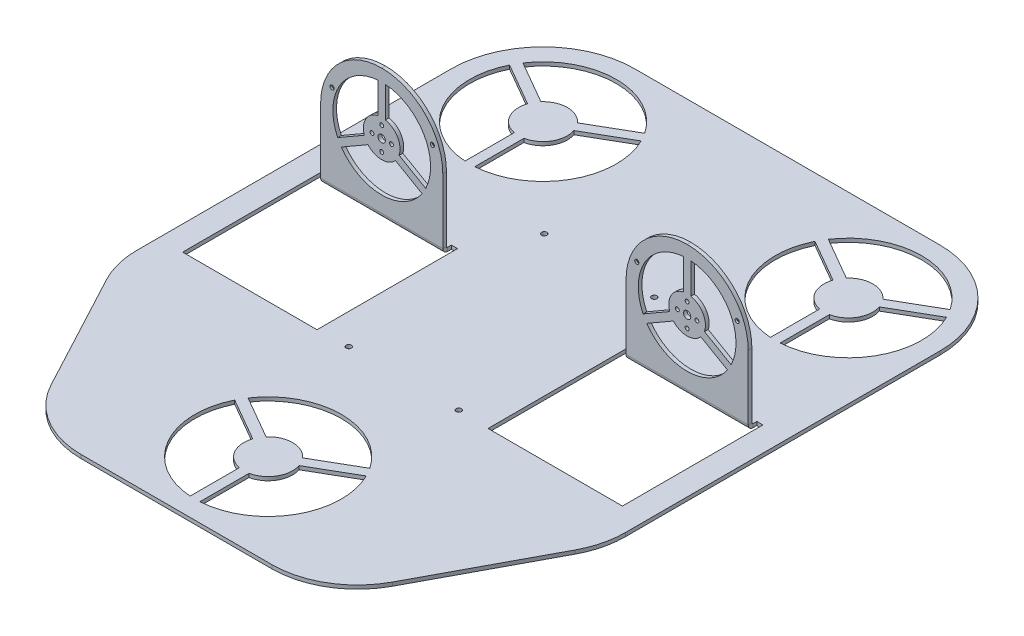
from build123d import *

# Parameters (mm, degrees)
BOSS_EXTRUDE1_DEPTH                                 = 3
FILLET1_R                                           = 70
CUT_EXTRUDE1_REACH                                  = 540.525
FILLET2_R                                           = 50
SKETCHED_BEND1_OUTLINE_W                            = 400
SKETCHED_BEND1_OUTLINE_H                            = 3
SKETCHED_BEND1_DEPTH                                = 202.963495408
SKETCHED_START                                      = 315
SKETCHED_BEND1_2_OUTLINE_W                          = 400
SKETCHED_BEND1_2_OUTLINE_H                          = 3
SKETCHED_BEND1_2_DEPTH                              = 185
SKETCHED_START_2                                    = 205.963495408
SKETCHED_BEND1_3_OUTLINE_W                          = 20
SKETCHED_BEND1_3_OUTLINE_H                          = 3
SKETCHED_BEND1_3_OUTLINE_W_2                        = 140
SKETCHED_BEND1_3_DEPTH                              = 109.036504592
SKETCHED_START_3                                    = 202.963495408
SKETCHED_BEND1_4_DEPTH                              = 3
SKETCHED_BEND1_5_DEPTH                              = 1
SKETCHED_START_4                                    = -201
SKETCHED_BEND1_6_DEPTH                              = 402
SKETCHED_START_5                                    = -175
SKETCHED_BEND1_7_DEPTH                              = 100
SKETCHED_START_6                                    = 75
SKETCHED_BEND1_8_DEPTH                              = 100
SKETCHED_START_7                                    = -75
SKETCHED_BEND1_9_DEPTH                              = 150
SKETCHED_BEND1_10_DEPTH                             = 26
SKETCHED_START_8                                    = 175
SKETCHED_BEND1_11_DEPTH                             = 26
SKETCH9_R                                           = 40
SKETCH9_R_2                                         = 15
CUT_EXTRUDE2_DEPTH                                  = 472.091933323
SKETCH16_W                                          = 6
SKETCH16_H                                          = 35.212980397
BOSS_EXTRUDE2_DEPTH                                 = 3
CIRPATTERN1_COUNT                                   = 3
SKETCH19_W                                          = 6
SKETCH19_H                                          = 35.212980397
BOSS_EXTRUDE3_DEPTH                                 = 3
CIRPATTERN2_COUNT                                   = 3
M3_CLEARANCE_HOLE1_D                                = 3.2
CUT_EXTRUDE3_REACH                                  = 473.092
SKETCH22_R                                          = 3
CSK_FOR_M3_COUNTERSUNK_FLAT_HEAD_SCREW3_D           = 3.4
CSK_FOR_M3_COUNTERSUNK_FLAT_HEAD_SCREW3_CSINK_D     = 6.3
CSK_FOR_M3_COUNTERSUNK_FLAT_HEAD_SCREW3_CSINK_ANGLE = 90
M4_CLEARANCE_HOLE1_D                                = 4.3


with BuildPart() as part:
    # Sketch1 → Boss-Extrude1 (new body)
    with BuildSketch(Plane.XY):
        with BuildLine():
            Line((-200, 350), (-120, 500))
            Line((-120, 500), (120, 500))
            Line((120, 500), (200, 350))
            Line((200, 350), (200, 75))
            ThreePointArc((200, 75), (178.033008589, 21.966991411), (125, 0))
            Line((125, 0), (-125, 0))
            ThreePointArc((-125, 0), (-178.033008589, 21.966991411), (-200, 75))
            Line((-200, 75), (-200, 350))
        make_face()
        with BuildLine():
            Line((-143.970562748, 68.666142644), (-178.845925587, 48.530842521))
            ThreePointArc((-178.845925587, 48.530842521), (-176.961524227, 105), (-129, 134.866518188))
            Line((-129, 134.866518188), (-129, 94.595917942))
            ThreePointArc((-129, 94.595917942), (-142.320508076, 85), (-143.970562748, 68.666142644))
        make_face(mode=Mode.SUBTRACT)
        with BuildLine():
            Line((-139.970562748, 61.737939414), (-174.845925587, 41.602639291))
            ThreePointArc((-174.845925587, 41.602639291), (-125, 15), (-75.154074413, 41.602639291))
            Line((-75.154074413, 41.602639291), (-110.029437252, 61.737939414))
            ThreePointArc((-110.029437252, 61.737939414), (-125, 55), (-139.970562748, 61.737939414))
        make_face(mode=Mode.SUBTRACT)
        with BuildLine():
            Line((-14.970562748, 411.737939414), (-49.845925587, 391.602639291))
            ThreePointArc((-49.845925587, 391.602639291), (0, 365), (49.845925587, 391.602639291))
            Line((49.845925587, 391.602639291), (14.970562748, 411.737939414))
            ThreePointArc((14.970562748, 411.737939414), (0, 405), (-14.970562748, 411.737939414))
        make_face(mode=Mode.SUBTRACT)
        with BuildLine():
            Line((-18.970562748, 418.666142644), (-53.845925587, 398.530842521))
            ThreePointArc((-53.845925587, 398.530842521), (-51.961524227, 455), (-4, 484.866518188))
            Line((-4, 484.866518188), (-4, 444.595917942))
            ThreePointArc((-4, 444.595917942), (-17.320508076, 435), (-18.970562748, 418.666142644))
        make_face(mode=Mode.SUBTRACT)
        with BuildLine():
            Line((4, 444.595917942), (4, 484.866518188))
            ThreePointArc((4, 484.866518188), (51.961524227, 455), (53.845925587, 398.530842521))
            Line((53.845925587, 398.530842521), (18.970562748, 418.666142644))
            ThreePointArc((18.970562748, 418.666142644), (17.320508076, 435), (4, 444.595917942))
        make_face(mode=Mode.SUBTRACT)
        with BuildLine():
            Line((-121, 94.595917942), (-121, 134.866518188))
            ThreePointArc((-121, 134.866518188), (-73.038475773, 105), (-71.154074413, 48.530842521))
            Line((-71.154074413, 48.530842521), (-106.029437252, 68.666142644))
            ThreePointArc((-106.029437252, 68.666142644), (-107.679491924, 85), (-121, 94.595917942))
        make_face(mode=Mode.SUBTRACT)
        with BuildLine():
            Line((129, 94.595917942), (129, 134.866518188))
            ThreePointArc((129, 134.866518188), (176.961524227, 105), (178.845925587, 48.530842521))
            Line((178.845925587, 48.530842521), (143.970562748, 68.666142644))
            ThreePointArc((143.970562748, 68.666142644), (142.320508076, 85), (129, 94.595917942))
        make_face(mode=Mode.SUBTRACT)
        with BuildLine():
            Line((139.970562748, 61.737939414), (174.845925587, 41.602639291))
            ThreePointArc((174.845925587, 41.602639291), (125, 15), (75.154074413, 41.602639291))
            Line((75.154074413, 41.602639291), (110.029437252, 61.737939414))
            ThreePointArc((110.029437252, 61.737939414), (125, 55), (139.970562748, 61.737939414))
        make_face(mode=Mode.SUBTRACT)
        with BuildLine():
            Line((106.029437252, 68.666142644), (71.154074413, 48.530842521))
            ThreePointArc((71.154074413, 48.530842521), (73.038475773, 105), (121, 134.866518188))
            Line((121, 134.866518188), (121, 94.595917942))
            ThreePointArc((121, 94.595917942), (107.679491924, 85), (106.029437252, 68.666142644))
        make_face(mode=Mode.SUBTRACT)
    extrude(amount=BOSS_EXTRUDE1_DEPTH)

    # Fillet1
    fillet1_edges = [part.edges().sort_by_distance(p)[0] for p in [
        (-200, 350, 1.5),
        (-120, 500, 1.5),
        (120, 500, 1.5),
        (200, 350, 1.5),
    ]]
    fillet(fillet1_edges, radius=FILLET1_R)

    # Sketch2 → Cut-Extrude1 (cut, up to next)
    with BuildSketch(Plane.XY.offset(3), mode=Mode.PRIVATE) as cut_extrude1_sk1:
        Polygon((-75, 200), (-70, 200), (-70, 315), (-180, 315), (-180, 200), (-175, 200), (-175, 310), (-75, 310), align=None)
    cut_extrude1_tool1 = extrude(cut_extrude1_sk1.sketch, amount=-CUT_EXTRUDE1_REACH, mode=Mode.PRIVATE) & part.part
    # Sketch2 → Cut-Extrude1 (cut, up to next)
    with BuildSketch(Plane.XY.offset(3), mode=Mode.PRIVATE) as cut_extrude1_sk2:
        Polygon((175, 200), (180, 200), (180, 315), (70, 315), (70, 200), (75, 200), (75, 310), (175, 310), align=None)
    cut_extrude1_tool2 = extrude(cut_extrude1_sk2.sketch, amount=-CUT_EXTRUDE1_REACH, mode=Mode.PRIVATE) & part.part
    add(cut_extrude1_tool1.solids().sort_by_distance((-72.5, 201.591383, 3))[0], mode=Mode.SUBTRACT)
    add(cut_extrude1_tool2.solids().sort_by_distance((177.5, 201.591383, 3))[0], mode=Mode.SUBTRACT)

    # Fillet2
    fillet2_edges = [part.edges().sort_by_distance(p)[0] for p in [
        (-175, 310, 1.5),
        (-75, 310, 1.5),
        (75, 310, 1.5),
        (175, 310, 1.5),
    ]]
    fillet(fillet2_edges, radius=FILLET2_R - 0.0001)  # a hair under: the kernel refuses the full size

    # Sketched Bend1: read off the stored shape, not the designer's step
    # Sketched Bend1 outline → Sketched Bend1 (cut)
    with BuildSketch(Plane(origin=(0, 0, 0), x_dir=(1, 0, 0), z_dir=(0, 1, 0))):
        with Locations((0, -1.5)):
            Rectangle(SKETCHED_BEND1_OUTLINE_W, SKETCHED_BEND1_OUTLINE_H)
    extrude(amount=SKETCHED_BEND1_DEPTH, mode=Mode.SUBTRACT)

    # Sketched Bend1 2 outline → Sketched Bend1 2 (cut)
    with BuildSketch(Plane(origin=(0, 0, 0), x_dir=(1, 0, 0), z_dir=(0, 1, 0)).offset(SKETCHED_START)):
        with Locations((0, -1.5)):
            Rectangle(SKETCHED_BEND1_2_OUTLINE_W, SKETCHED_BEND1_2_OUTLINE_H)
    extrude(amount=SKETCHED_BEND1_2_DEPTH, mode=Mode.SUBTRACT)

    # Sketched Bend1 3 outline → Sketched Bend1 3 (cut)
    with BuildSketch(Plane(origin=(0, 0, 0), x_dir=(1, 0, 0), z_dir=(0, 1, 0)).offset(SKETCHED_START_2)):
        with Locations((190, -1.5)):
            Rectangle(SKETCHED_BEND1_3_OUTLINE_W, SKETCHED_BEND1_3_OUTLINE_H)
        with Locations((0, -1.5)):
            Rectangle(SKETCHED_BEND1_3_OUTLINE_W_2, SKETCHED_BEND1_3_OUTLINE_H)
        with Locations((-190, -1.5)):
            Rectangle(SKETCHED_BEND1_3_OUTLINE_W, SKETCHED_BEND1_3_OUTLINE_H)
    extrude(amount=SKETCHED_BEND1_3_DEPTH, mode=Mode.SUBTRACT)

    # Sketched Bend1 4 outline → Sketched Bend1 4 (add)
    # profile 1 of 2: a face of its own
    with BuildSketch(Plane(origin=(0, 0, 0), x_dir=(1, 0, 0), z_dir=(0, 1, 0)).offset(SKETCHED_START_3)):
        with BuildLine():
            Line((175, 0), (175, 4.036504592))
            Line((175, 4.036504592), (180, 4.036504592))
            Line((180, 4.036504592), (180, 0))
            Line((180, 0), (200, 0))
            Line((200, 0), (200, 129.036504592))
            ThreePointArc((200, 129.036504592), (178.033008588, 182.06951318), (125, 204.036504592))
            Line((125, 204.036504592), (-125, 204.036504592))
            ThreePointArc((-125, 204.036504592), (-178.033008588, 182.06951318), (-200, 129.036504592))
            Line((-200, 129.036504592), (-200, 0))
            Line((-200, 0), (-180, 0))
            Line((-180, 0), (-180, 4.036504592))
            Line((-180, 4.036504592), (-175, 4.036504592))
            Line((-175, 4.036504592), (-175, 0))
            Line((-175, 0), (-75, 0))
            Line((-75, 0), (-75, 4.036504592))
            Line((-75, 4.036504592), (-70, 4.036504592))
            Line((-70, 4.036504592), (-70, 0))
            Line((-70, 0), (70, 0))
            Line((70, 0), (70, 4.036504592))
            Line((70, 4.036504592), (75, 4.036504592))
            Line((75, 4.036504592), (75, 0))
            Line((75, 0), (175, 0))
        make_face()
        with BuildLine():
            Line((-178.845925587, 155.505662071), (-143.970562748, 135.370361948))
            ThreePointArc((-143.970562748, 135.370361948), (-142.320508076, 119.036504592), (-129, 109.440586649))
            Line((-129, 109.440586649), (-129, 69.169986403))
            ThreePointArc((-129, 69.169986403), (-176.961524227, 99.036504592), (-178.845925587, 155.505662071))
        make_face(mode=Mode.SUBTRACT)
        with BuildLine():
            ThreePointArc((-174.845925587, 162.433865301), (-125, 189.036504592), (-75.154074413, 162.433865301))
            Line((-75.154074413, 162.433865301), (-110.029437252, 142.298565178))
            ThreePointArc((-110.029437252, 142.298565178), (-125, 149.036504592), (-139.970562748, 142.298565178))
            Line((-139.970562748, 142.298565178), (-174.845925587, 162.433865301))
        make_face(mode=Mode.SUBTRACT)
        with BuildLine():
            Line((-121, 69.169986403), (-121, 109.440586649))
            ThreePointArc((-121, 109.440586649), (-107.679491924, 119.036504592), (-106.029437252, 135.370361948))
            Line((-106.029437252, 135.370361948), (-71.154074413, 155.505662071))
            ThreePointArc((-71.154074413, 155.505662071), (-73.038475773, 99.036504592), (-121, 69.169986403))
        make_face(mode=Mode.SUBTRACT)
        with BuildLine():
            Line((71.154074413, 155.505662071), (106.029437252, 135.370361947))
            ThreePointArc((106.029437252, 135.370361947), (107.679491924, 119.036504591), (121, 109.440586649))
            Line((121, 109.440586649), (121, 69.169986403))
            ThreePointArc((121, 69.169986403), (73.038475773, 99.036504592), (71.154074413, 155.505662071))
        make_face(mode=Mode.SUBTRACT)
        with BuildLine():
            ThreePointArc((178.845925587, 155.505662071), (176.961524227, 99.036504592), (129, 69.169986403))
            Line((129, 69.169986403), (129, 109.440586649))
            ThreePointArc((129, 109.440586649), (142.320508076, 119.036504592), (143.970562748, 135.370361948))
            Line((143.970562748, 135.370361948), (178.845925587, 155.505662071))
        make_face(mode=Mode.SUBTRACT)
        with BuildLine():
            Line((174.845925587, 162.433865301), (139.970562748, 142.298565178))
            ThreePointArc((139.970562748, 142.298565178), (125, 149.036504592), (110.029437252, 142.298565178))
            Line((110.029437252, 142.298565178), (75.154074413, 162.433865301))
            ThreePointArc((75.154074413, 162.433865301), (125, 189.036504592), (174.845925587, 162.433865301))
        make_face(mode=Mode.SUBTRACT)
    # profile 2 of 2: a face of its own
    with BuildSketch(Plane(origin=(0, 0, 0), x_dir=(1, 0, 0), z_dir=(0, 1, 0)).offset(SKETCHED_START_3)):
        with BuildLine():
            Line((200, -3), (180, -3))
            Line((180, -3), (180, -110.963495408))
            Line((180, -110.963495408), (70, -110.963495408))
            Line((70, -110.963495408), (70, -3))
            Line((70, -3), (-70, -3))
            Line((-70, -3), (-70, -110.963495408))
            Line((-70, -110.963495408), (-180, -110.963495408))
            Line((-180, -110.963495408), (-180, -3))
            Line((-180, -3), (-200, -3))
            Line((-200, -3), (-200, -128.463495408))
            ThreePointArc((-200, -128.463495408), (-197.90997501, -145.440989161), (-191.764705882, -161.404671879))
            Line((-191.764705882, -161.404671879), (-139.764705882, -258.904671879))
            ThreePointArc((-139.764705882, -258.904671879), (-114.01470288, -285.988000208), (-78, -295.963495408))
            Line((-78, -295.963495408), (78, -295.963495408))
            ThreePointArc((78, -295.963495408), (114.01470288, -285.988000208), (139.764705882, -258.904671879))
            Line((139.764705882, -258.904671879), (191.764705882, -161.404671879))
            ThreePointArc((191.764705882, -161.404671879), (197.90997501, -145.440989161), (200, -128.463495408))
            Line((200, -128.463495408), (200, -3))
        make_face()
        with BuildLine():
            Line((-53.845925587, -194.494337929), (-18.970562748, -214.629638052))
            ThreePointArc((-18.970562748, -214.629638052), (-17.320508076, -230.963495408), (-4, -240.559413351))
            Line((-4, -240.559413351), (-4, -280.830013597))
            ThreePointArc((-4, -280.830013597), (-51.961524227, -250.963495408), (-53.845925587, -194.494337929))
        make_face(mode=Mode.SUBTRACT)
        with BuildLine():
            ThreePointArc((53.845925587, -194.494337929), (51.961524227, -250.963495408), (4, -280.830013597))
            Line((4, -280.830013597), (4, -240.559413351))
            ThreePointArc((4, -240.559413351), (17.320508076, -230.963495408), (18.970562748, -214.629638052))
            Line((18.970562748, -214.629638052), (53.845925587, -194.494337929))
        make_face(mode=Mode.SUBTRACT)
        with BuildLine():
            Line((49.845925587, -187.566134699), (14.970562748, -207.701434822))
            ThreePointArc((14.970562748, -207.701434822), (0, -200.963495408), (-14.970562748, -207.701434822))
            Line((-14.970562748, -207.701434822), (-49.845925587, -187.566134699))
            ThreePointArc((-49.845925587, -187.566134699), (0, -160.963495408), (49.845925587, -187.566134699))
        make_face(mode=Mode.SUBTRACT)
    extrude(amount=SKETCHED_BEND1_4_DEPTH)

    # Sketched Bend1 5 outline → Sketched Bend1 5 (add)
    with BuildSketch(Plane(origin=(0, 0, 0), x_dir=(1, 0, 0), z_dir=(0, 1, 0)).offset(SKETCHED_START_2)):
        with BuildLine():
            Line((175, 0), (175, 4.036504592))
            Line((175, 4.036504592), (180, 4.036504592))
            Line((180, 4.036504592), (180, 0))
            Line((180, 0), (200, 0))
            Line((200, 0), (200, 129.036504592))
            ThreePointArc((200, 129.036504592), (178.033008588, 182.06951318), (125, 204.036504592))
            Line((125, 204.036504592), (-125, 204.036504592))
            ThreePointArc((-125, 204.036504592), (-178.033008588, 182.06951318), (-200, 129.036504592))
            Line((-200, 129.036504592), (-200, 0))
            Line((-200, 0), (-180, 0))
            Line((-180, 0), (-180, 4.036504592))
            Line((-180, 4.036504592), (-175, 4.036504592))
            Line((-175, 4.036504592), (-175, 0))
            Line((-175, 0), (-75, 0))
            Line((-75, 0), (-75, 4.036504592))
            Line((-75, 4.036504592), (-70, 4.036504592))
            Line((-70, 4.036504592), (-70, 0))
            Line((-70, 0), (70, 0))
            Line((70, 0), (70, 4.036504592))
            Line((70, 4.036504592), (75, 4.036504592))
            Line((75, 4.036504592), (75, 0))
            Line((75, 0), (175, 0))
        make_face()
        with BuildLine():
            Line((-178.845925587, 155.505662071), (-143.970562748, 135.370361948))
            ThreePointArc((-143.970562748, 135.370361948), (-142.320508076, 119.036504592), (-129, 109.440586649))
            Line((-129, 109.440586649), (-129, 69.169986403))
            ThreePointArc((-129, 69.169986403), (-176.961524227, 99.036504592), (-178.845925587, 155.505662071))
        make_face(mode=Mode.SUBTRACT)
        with BuildLine():
            ThreePointArc((-174.845925587, 162.433865301), (-125, 189.036504592), (-75.154074413, 162.433865301))
            Line((-75.154074413, 162.433865301), (-110.029437252, 142.298565178))
            ThreePointArc((-110.029437252, 142.298565178), (-125, 149.036504592), (-139.970562748, 142.298565178))
            Line((-139.970562748, 142.298565178), (-174.845925587, 162.433865301))
        make_face(mode=Mode.SUBTRACT)
        with BuildLine():
            Line((-121, 69.169986403), (-121, 109.440586649))
            ThreePointArc((-121, 109.440586649), (-107.679491924, 119.036504592), (-106.029437252, 135.370361948))
            Line((-106.029437252, 135.370361948), (-71.154074413, 155.505662071))
            ThreePointArc((-71.154074413, 155.505662071), (-73.038475773, 99.036504592), (-121, 69.169986403))
        make_face(mode=Mode.SUBTRACT)
        with BuildLine():
            Line((71.154074413, 155.505662071), (106.029437252, 135.370361947))
            ThreePointArc((106.029437252, 135.370361947), (107.679491924, 119.036504591), (121, 109.440586649))
            Line((121, 109.440586649), (121, 69.169986403))
            ThreePointArc((121, 69.169986403), (73.038475773, 99.036504592), (71.154074413, 155.505662071))
        make_face(mode=Mode.SUBTRACT)
        with BuildLine():
            ThreePointArc((178.845925587, 155.505662071), (176.961524227, 99.036504592), (129, 69.169986403))
            Line((129, 69.169986403), (129, 109.440586649))
            ThreePointArc((129, 109.440586649), (142.320508076, 119.036504592), (143.970562748, 135.370361948))
            Line((143.970562748, 135.370361948), (178.845925587, 155.505662071))
        make_face(mode=Mode.SUBTRACT)
        with BuildLine():
            Line((174.845925587, 162.433865301), (139.970562748, 142.298565178))
            ThreePointArc((139.970562748, 142.298565178), (125, 149.036504592), (110.029437252, 142.298565178))
            Line((110.029437252, 142.298565178), (75.154074413, 162.433865301))
            ThreePointArc((75.154074413, 162.433865301), (125, 189.036504592), (174.845925587, 162.433865301))
        make_face(mode=Mode.SUBTRACT)
    extrude(amount=SKETCHED_BEND1_5_DEPTH)

    # Sketched Bend1 6 outline → Sketched Bend1 6 (cut)
    with BuildSketch(Plane.YZ.offset(SKETCHED_START_4)):
        with BuildLine():
            ThreePointArc((205.963495408, 2.872983346), (206.459478238, 2.968118785), (206.963495408, 3))
            Line((206.963495408, 3), (205.963495408, 3))
            Line((205.963495408, 3), (205.963495408, 2.872983346))
        make_face()
        with BuildLine():
            ThreePointArc((206.963495408, 0), (206.256388627, -0.292893219), (205.963495408, -1))
            Line((205.963495408, -1), (205.963495408, -204.036504592))
            Line((205.963495408, -204.036504592), (206.963495408, -204.036504592))
            Line((206.963495408, -204.036504592), (206.963495408, 0))
        make_face()
    extrude(amount=SKETCHED_BEND1_6_DEPTH, mode=Mode.SUBTRACT)

    # Sketched Bend1 7 outline → Sketched Bend1 7 (cut)
    with BuildSketch(Plane.YZ.offset(SKETCHED_START_5)):
        with BuildLine():
            ThreePointArc((202.963495408, -1), (203.801217748, 1.449489743), (205.963495408, 2.872983346))
            Line((205.963495408, 2.872983346), (205.963495408, 3))
            Line((205.963495408, 3), (202.963495408, 3))
            Line((202.963495408, 3), (202.963495408, -1))
        make_face()
    extrude(amount=SKETCHED_BEND1_7_DEPTH, mode=Mode.SUBTRACT)

    # Sketched Bend1 8 outline → Sketched Bend1 8 (cut)
    with BuildSketch(Plane.YZ.offset(SKETCHED_START_6)):
        with BuildLine():
            ThreePointArc((202.963495408, -1), (203.801217748, 1.449489743), (205.963495408, 2.872983346))
            Line((205.963495408, 2.872983346), (205.963495408, 3))
            Line((205.963495408, 3), (202.963495408, 3))
            Line((202.963495408, 3), (202.963495408, -1))
        make_face()
    extrude(amount=SKETCHED_BEND1_8_DEPTH, mode=Mode.SUBTRACT)

    # Sketched Bend1 9 outline → Sketched Bend1 9 (cut)
    with BuildSketch(Plane.YZ.offset(SKETCHED_START_7)):
        with BuildLine():
            Line((206.963495408, 0), (205.963495408, 0))
            Line((205.963495408, 0), (205.963495408, -1))
            ThreePointArc((205.963495408, -1), (206.256388627, -0.292893219), (206.963495408, 0))
        make_face()
    extrude(amount=SKETCHED_BEND1_9_DEPTH, mode=Mode.SUBTRACT)

    # Sketched Bend1 10 outline → Sketched Bend1 10 (cut)
    with BuildSketch(Plane.YZ.offset(SKETCHED_START_4)):
        with BuildLine():
            Line((206.963495408, 0), (205.963495408, 0))
            Line((205.963495408, 0), (205.963495408, -1))
            ThreePointArc((205.963495408, -1), (206.256388627, -0.292893219), (206.963495408, 0))
        make_face()
    extrude(amount=SKETCHED_BEND1_10_DEPTH, mode=Mode.SUBTRACT)

    # Sketched Bend1 11 outline → Sketched Bend1 11 (cut)
    with BuildSketch(Plane.YZ.offset(SKETCHED_START_8)):
        with BuildLine():
            Line((206.963495408, 0), (205.963495408, 0))
            Line((205.963495408, 0), (205.963495408, -1))
            ThreePointArc((205.963495408, -1), (206.256388627, -0.292893219), (206.963495408, 0))
        make_face()
    extrude(amount=SKETCHED_BEND1_11_DEPTH, mode=Mode.SUBTRACT)

    # Sketch9 → Cut-Extrude2 (cut, through all)
    # profile 1 of 2: a face of its own
    with BuildSketch(Plane.XY.offset(3)):
        with Locations((-125, 260)):
            Circle(SKETCH9_R)
        with Locations((-125, 260)):
            Circle(SKETCH9_R_2, mode=Mode.SUBTRACT)
    # profile 2 of 2: a face of its own
    with BuildSketch(Plane.XY.offset(3)):
        with Locations((125, 260)):
            Circle(SKETCH9_R)
        with Locations((125, 260)):
            Circle(SKETCH9_R_2, mode=Mode.SUBTRACT)
    extrude(amount=-CUT_EXTRUDE2_DEPTH, mode=Mode.SUBTRACT)


with BuildPart() as cut_extrude2_piece_1:
    # of the separate pieces the step leaves, piece 1, a body of its own (cut_extrude2_pieces)
    add(part.part.solids().sort_by_distance((175, 260.0001, 0))[0])



with BuildPart() as cut_extrude2_piece_2:
    # of the separate pieces the step leaves, piece 2, a body of its own (cut_extrude2_pieces)
    add(part.part.solids().sort_by_distance((140, 260, 0))[0])


with BuildPart() as cut_extrude2_piece_3:
    # of the separate pieces the step leaves, piece 3, a body of its own (cut_extrude2_pieces)
    add(part.part.solids().sort_by_distance((-110, 260, 0))[0])


with BuildPart() as cut_extrude2_piece_1_1:
    add(cut_extrude2_piece_1.part)

    add(cut_extrude2_piece_3.part)  # Boss-Extrude2 merges Cut-Extrude2 piece 3
    # Sketch16 → Boss-Extrude2 (add)
    with BuildSketch(Plane.XY.offset(3)):
        with Locations((-125, 292.303428656)):
            Rectangle(SKETCH16_W, SKETCH16_H)
    boss_extrude2 = extrude(amount=-BOSS_EXTRUDE2_DEPTH)

    # CirPattern1: Boss-Extrude2 ×3 about axis
    cirpattern1_axis = Axis((-125, 260, 0), (0, 0, 1))
    for i in range(1, CIRPATTERN1_COUNT):
        add(boss_extrude2.rotate(cirpattern1_axis, i * 360 / CIRPATTERN1_COUNT))


    add(cut_extrude2_piece_2.part)  # Boss-Extrude3 merges Cut-Extrude2 piece 2
    # Sketch19 → Boss-Extrude3 (add)
    with BuildSketch(Plane.XY.offset(3)):
        with Locations((125, 292.303428656)):
            Rectangle(SKETCH19_W, SKETCH19_H)
    boss_extrude3 = extrude(amount=-BOSS_EXTRUDE3_DEPTH)

    # CirPattern2: Boss-Extrude3 ×3 about axis
    cirpattern2_axis = Axis((125, 260, 0), (0, 0, 1))
    for i in range(1, CIRPATTERN2_COUNT):
        add(boss_extrude3.rotate(cirpattern2_axis, i * 360 / CIRPATTERN2_COUNT))

    # M3 Clearance Hole1 (through all)
    with Locations(Plane.XY.offset(3)):
        with Locations((-125, 269.5), (-125, 250.5), (-133, 260), (-117, 260), (-125, 260)):
            m3_clearance_hole1 = Hole(M3_CLEARANCE_HOLE1_D / 2)

    # Sketch22 → Cut-Extrude3 (cut, up to next)
    with BuildSketch(Plane.XY.offset(3), mode=Mode.PRIVATE) as cut_extrude3_sk1:
        with Locations((-125, 260)):
            Circle(SKETCH22_R)
    cut_extrude3_tool1 = extrude(cut_extrude3_sk1.sketch, amount=-CUT_EXTRUDE3_REACH, mode=Mode.PRIVATE) & cut_extrude2_piece_1_1.part
    cut_extrude3 = cut_extrude3_tool1.solids().sort_by_distance((-125, 260, 3))[0]
    add(cut_extrude3, mode=Mode.SUBTRACT)

    # Mirror1: M3 Clearance Hole1, Cut-Extrude3 across plane
    add(m3_clearance_hole1.mirror(Plane(origin=(0, 0, 0), x_dir=(0, 0, 1), z_dir=(1, 0, 0))), mode=Mode.SUBTRACT)
    add(cut_extrude3.mirror(Plane(origin=(0, 0, 0), x_dir=(0, 0, 1), z_dir=(1, 0, 0))), mode=Mode.SUBTRACT)

    # CSK for M3 Countersunk Flat Head Screw3 (through all)
    with Locations(Plane(origin=(0, 0, 0), x_dir=(-1, 0, 0), z_dir=(0, 0, -1))):
        with Locations((-125.588729382, 346.343542242), (-83.789316087, 277.051897383), (-165.985477802, 276.210298458), (165.689643288, 275.872555658), (83.529497195, 276.252926704), (125.273893117, 347.014910337)):
            CounterSinkHole(CSK_FOR_M3_COUNTERSUNK_FLAT_HEAD_SCREW3_D / 2, CSK_FOR_M3_COUNTERSUNK_FLAT_HEAD_SCREW3_CSINK_D / 2, counter_sink_angle=CSK_FOR_M3_COUNTERSUNK_FLAT_HEAD_SCREW3_CSINK_ANGLE)

    # M4 Clearance Hole1 (through all)
    with Locations(Plane(origin=(0, 205.963495408, 0), x_dir=(1, 0, 0), z_dir=(0, 1, 0))):
        with Locations((-45, 50.036504592), (45, 50.036504592), (45, -109.963495408), (-45, -109.963495408)):
            Hole(M4_CLEARANCE_HOLE1_D / 2)


solid = cut_extrude2_piece_1_1.part
